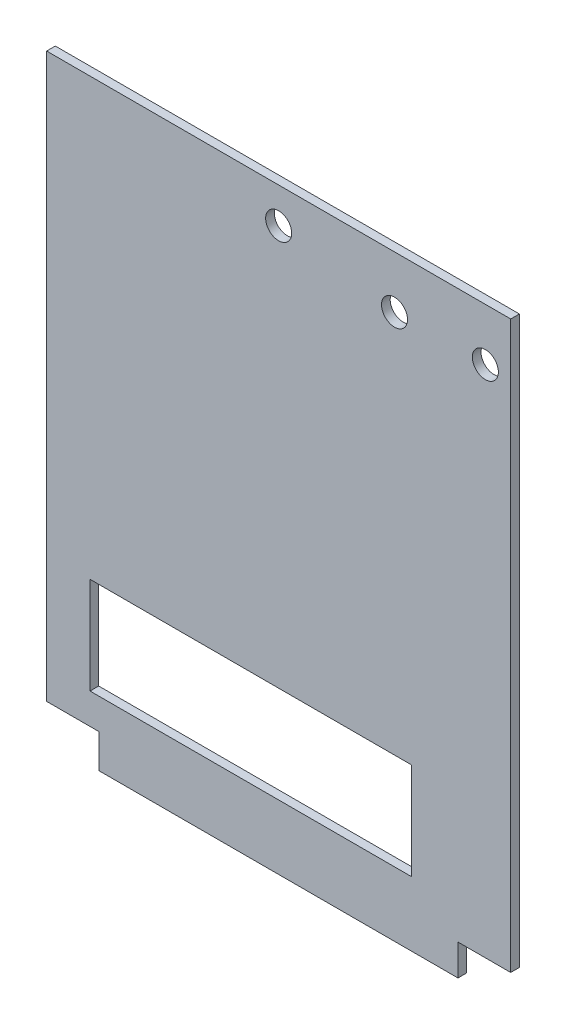
from build123d import *

# Parameters (mm, degrees)
SKETCH1_W           = 81.534
SKETCH1_H           = 104.902
BOSS_EXTRUDE1_DEPTH = 1.524
SKETCH2_W           = 9.17
SKETCH2_H           = 5.95
SKETCH2_W_2         = 9.266089767
SKETCH2_H_2         = 5.472
CUT_EXTRUDE1_DEPTH  = 1.524
SKETCH4_W           = 56.5
SKETCH4_H           = 17
CUT_EXTRUDE2_DEPTH  = 1.524
SKETCH6_R           = 2.285
CUT_EXTRUDE3_DEPTH  = 1.524


with BuildPart() as part:
    # Sketch1 → Boss-Extrude1 (new body)
    with BuildSketch(Plane.XY):
        with Locations((-2.046973799, -6.087681223)):
            Rectangle(SKETCH1_W, SKETCH1_H)
    extrude(amount=BOSS_EXTRUDE1_DEPTH)

    # Sketch2 → Cut-Extrude1 (cut)
    with BuildSketch(Plane.XY.offset(1.524)):
        with Locations((-38.228973799, -55.563681223)):
            Rectangle(SKETCH2_W, SKETCH2_H)
        with Locations((34.086981318, -55.802681223)):
            Rectangle(SKETCH2_W_2, SKETCH2_H_2)
    extrude(amount=-CUT_EXTRUDE1_DEPTH, mode=Mode.SUBTRACT)

    # Sketch4 → Cut-Extrude2 (cut)
    with BuildSketch(Plane.XY.offset(1.524)):
        with Locations((-6.933973799, -38.698681223)):
            Rectangle(SKETCH4_W, SKETCH4_H)
    extrude(amount=-CUT_EXTRUDE2_DEPTH, mode=Mode.SUBTRACT)

    # Sketch6 → Cut-Extrude3 (cut)
    with BuildSketch(Plane.XY.offset(1.524)):
        with Locations((-2.046973799, 40.158318777)):
            Circle(SKETCH6_R)
        with Locations((34.265026201, 37.193318777)):
            Circle(SKETCH6_R)
        with Locations((18.305026201, 37.193318777)):
            Circle(SKETCH6_R)
    extrude(amount=-CUT_EXTRUDE3_DEPTH, mode=Mode.SUBTRACT)


solid = part.part
